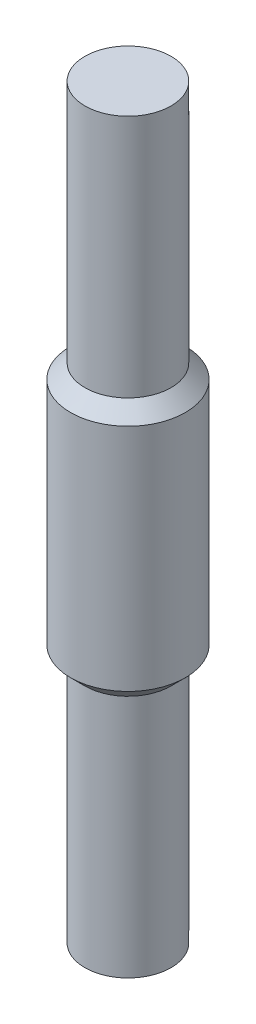
from build123d import *

# Parameters (mm, degrees)
SKETCH_1_R      = 2
EXTRUDE_1_DEPTH = 10
SKETCH_2_R      = 1.5
EXTRUDE_2_DEPTH = 8
EXTRUDE_START   = 8
SKETCH_3_R      = 1.5
EXTRUDE_3_DEPTH = 8
CHAMFER_1_SIZE  = 1


with BuildPart() as part:
    # 草图1 → 凸台-拉伸1 (new body)
    with BuildSketch(Plane(origin=(0, 0, 0), x_dir=(1, 0, 0), z_dir=(0, 1, 0))):
        with Locations(Location((0, 0, 0), (0, 0, 270))):
            Circle(SKETCH_1_R)
    extrude(amount=EXTRUDE_1_DEPTH)

    # 草图2 → 凸台-拉伸2 (add)
    with BuildSketch(Plane.XZ):
        with Locations(Location((0, 0, 0), (0, 0, 270))):
            Circle(SKETCH_2_R)
    extrude(amount=EXTRUDE_2_DEPTH)

    # 草图3 → 凸台-拉伸3 (add)
    with BuildSketch(Plane(origin=(0, 10, 0), x_dir=(1, 0, 0), z_dir=(0, 1, 0)).offset(EXTRUDE_START)):
        with Locations(Location((0, 0, 0), (0, 0, 90))):
            Circle(SKETCH_3_R)
    extrude(amount=-EXTRUDE_3_DEPTH)

    # 倒角1
    # the kernel refuses this chamfer: 1 mm, written as the material it takes off along each edge
    with BuildSketch(Plane(origin=(0, 0, 0), x_dir=(0, 0, 1), z_dir=(-1, 0, 0))) as chamfer_1_piece_1_section:
        Polygon((2, CHAMFER_1_SIZE), (2 - CHAMFER_1_SIZE, 0), (2, 0), align=None)
    chamfer_1_piece_1 = revolve(axis=Axis((0, 0, 0), (0, 1, 0)), mode=Mode.PRIVATE)
    chamfer_1_piece_1 = chamfer_1_piece_1 - Plane(origin=(0, 0.752378324, 0), x_dir=(0, 0, -1), z_dir=(0, 1, 0)) * Cylinder(1.5, 8, mode=Mode.PRIVATE)
    add(chamfer_1_piece_1, mode=Mode.SUBTRACT)
    with BuildSketch(Plane(origin=(0, 10, 0), x_dir=(0, 0, 1), z_dir=(-1, 0, 0))) as chamfer_1_piece_2_section:
        Polygon((2, -CHAMFER_1_SIZE), (2 - CHAMFER_1_SIZE, 0), (2, 0), align=None)
    chamfer_1_piece_2 = revolve(axis=Axis((0, 10, 0), (0, 1, 0)), mode=Mode.PRIVATE)
    chamfer_1_piece_2 = chamfer_1_piece_2 - Plane(origin=(0, 9.247621676, 0), x_dir=(0, 0, -1), z_dir=(0, 1, 0)) * Cylinder(1.5, 8, mode=Mode.PRIVATE)
    add(chamfer_1_piece_2, mode=Mode.SUBTRACT)


solid = part.part
